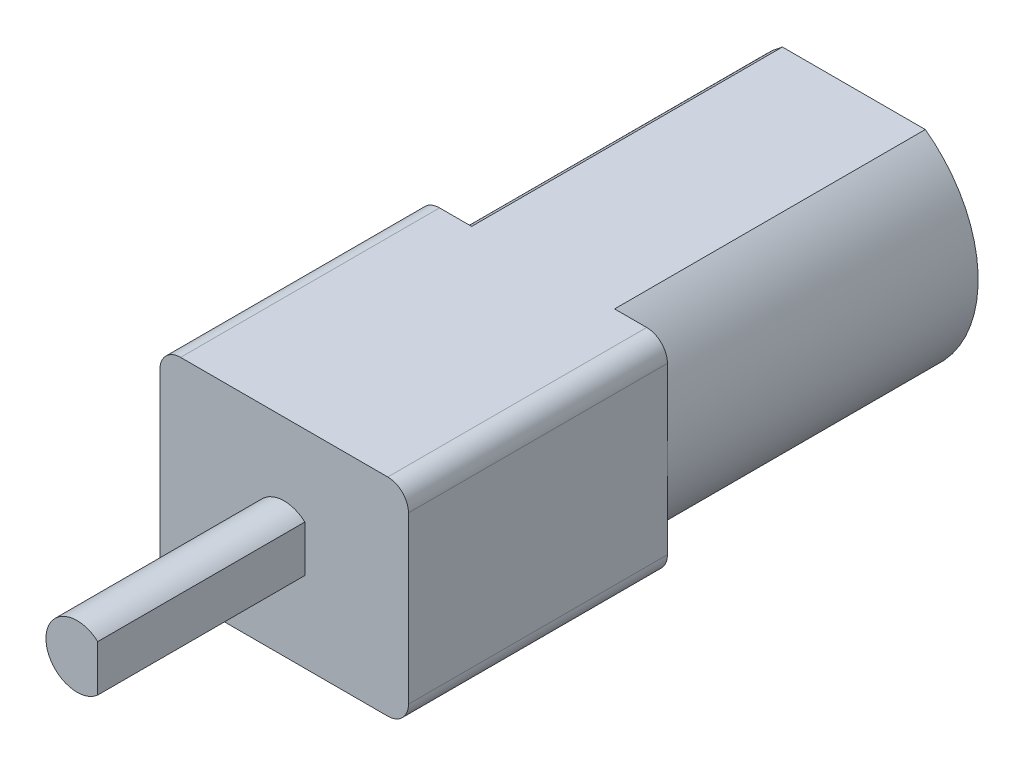
from build123d import *

# Parameters (mm, degrees)
BOSS_EXTRUDE1_DEPTH = 15
SKETCH2_W           = 12
SKETCH2_H           = 10
BOSS_EXTRUDE2_DEPTH = 12.5
FILLET1_R           = 1
BOSS_EXTRUDE3_DEPTH = 10
SKETCH4_R           = 2.5
BOSS_EXTRUDE4_DEPTH = 1.2


with BuildPart() as part:
    # Sketch1 → Boss-Extrude1 (new body)
    with BuildSketch(Plane.XY):
        with BuildLine():
            Line((-3.45, 5), (3.45, 5))
            ThreePointArc((3.45, 5), (6, 0), (3.45, -5))
            Line((3.45, -5), (-3.45, -5))
            ThreePointArc((-3.45, -5), (-6, 0), (-3.45, 5))
        make_face()
    extrude(amount=BOSS_EXTRUDE1_DEPTH)

    # Sketch2 → Boss-Extrude2 (add)
    with BuildSketch(Plane.XY.offset(15)):
        Rectangle(SKETCH2_W, SKETCH2_H)
    extrude(amount=BOSS_EXTRUDE2_DEPTH)

    # Fillet1
    fillet1_edges = [part.edges().sort_by_distance(p)[0] for p in [
        (6, 5, 21.25),
        (6, -5, 21.25),
        (-6, -5, 21.25),
        (-6, 5, 21.25),
    ]]
    fillet(fillet1_edges, radius=FILLET1_R)

    # Sketch3 → Boss-Extrude3 (add)
    with BuildSketch(Plane.XY.offset(27.5)):
        with BuildLine():
            Line((1, 1.118033989), (1, -1.118033989))
            ThreePointArc((1, -1.118033989), (-1.5, 0), (1, 1.118033989))
        make_face()
    extrude(amount=BOSS_EXTRUDE3_DEPTH)

    # Sketch4 → Boss-Extrude4 (add)
    with BuildSketch(Plane(origin=(0, 0, 0), x_dir=(-1, 0, 0), z_dir=(0, 0, -1))):
        Circle(SKETCH4_R)
    extrude(amount=BOSS_EXTRUDE4_DEPTH)


solid = part.part
